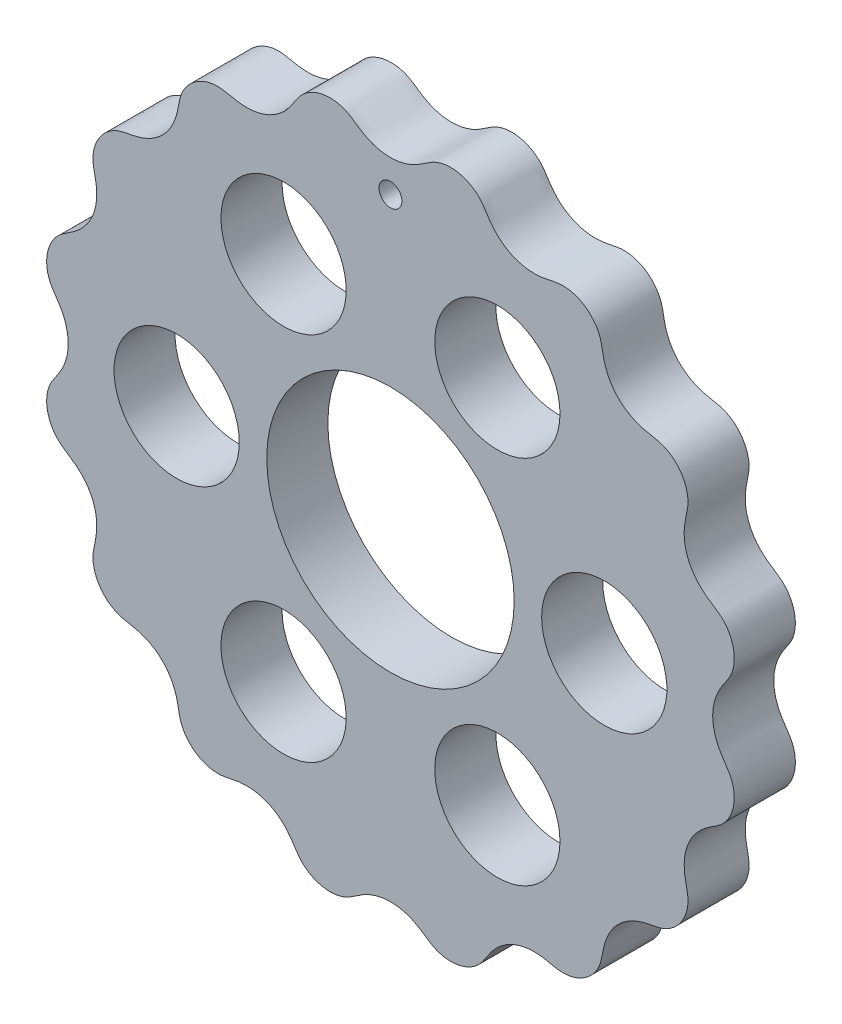
from build123d import *

# Parameters (mm, degrees)
CYCLOIDAL_START          = -4
CYCLOIDAL_SHAPE_DEPTH    = 8
SKETCH3_R                = 8.2
OUTPUT_HOLES_DEPTH       = 64.798186632
CIRPATTERN1_COUNT        = 6
CENTER_HOLE_DEPTH        = 64.798186632
CENTER_HOLE_DEPTH_BACK   = 64.798186632
SKETCH4_R                = 16.2
INDICATORHOLE_DEPTH      = 64.798186632
INDICATORHOLE_DEPTH_BACK = 64.798186632
SKETCH5_R                = 1.5


# Read off the part's stored shape, not the designer's step: Cycloidal Shape
with BuildPart() as part:
    # Cycloidal Shape outline → Cycloidal Shape (new body)
    with BuildSketch(Plane.XY.offset(CYCLOIDAL_START)):
        with BuildLine():
            Line((42.200000004, -6.0471e-05), (42.200000175, 0.001422933))
            add(Edge.make_bspline(
                [(42.200000175, 0.001422933), (42.200009793, 0.04429638), (42.201002333, 0.130355213), (42.205417899, 0.291208552), (42.217134936, 0.502376445), (42.23904282, 0.748307484), (42.276902172, 1.043005139), (42.355187031, 1.4864807), (42.504519261, 2.064777059), (42.714725772, 2.648408909), (42.986238981, 3.226181743), (43.259216415, 3.714406212), (43.514029767, 4.120442952), (43.78394798, 4.516656663), (44.058339029, 4.909655929), (44.386909136, 5.410933524), (44.747004457, 6.120481722), (45.016624744, 7.078299883), (45.070836347, 8.260501124), (44.840754087, 9.489174205), (44.381613563, 10.534977592), (43.775181626, 11.370409062), (43.087990008, 11.996449006), (42.396002443, 12.445761838), (41.693744098, 12.892169721), (41.018846878, 13.397659966), (40.392611683, 13.97543943), (39.832459458, 14.630187804), (39.233382075, 15.534850433), (38.702787982, 16.736621625), (38.432884001, 18.062354346), (38.448481733, 19.31657631), (38.582059738, 20.240796265), (38.704812873, 20.847729863), (38.812157151, 21.331100124), (38.907481526, 21.817359974), (38.964178522, 22.310094094), (38.97060628, 22.84827074), (38.910160022, 23.425564167), (38.731729101, 24.194195487), (38.352986348, 25.091100898), (37.72440338, 26.014438605), (36.849672277, 26.813178086), (36.008868598, 27.292153775), (35.276321466, 27.542000539), (34.592769181, 27.691977179), (33.902946723, 27.807011833), (33.120228086, 27.972287117), (32.262312537, 28.2481261), (31.260996096, 28.706068431), (30.183688369, 29.430209), (29.132775396, 30.519874956), (28.379656033, 31.843560482), (27.971405052, 33.084801198), (27.758536044, 34.166387243), (27.615539083, 35.059190189), (27.308374398, 35.996628219), (26.763805752, 36.912551543), (25.996094164, 37.732482419), (25.020461355, 38.396369714), (24.043230305, 38.791092717), (23.132974045, 38.965842478), (22.313461012, 38.976357024), (21.607198684, 38.876669717), (20.833553837, 38.69803688), (19.972179417, 38.527741317), (19.013370325, 38.436032664), (17.966856414, 38.481564914), (16.739227402, 38.720629378), (15.602325707, 39.180306698), (14.597997584, 39.829155361), (13.744609822, 40.620546383), (13.144351887, 41.335918565), (12.618250937, 42.108661247), (12.132222708, 42.910020292), (11.574470243, 43.575714973), (10.960536027, 44.077622647), (10.207813306, 44.528444357), (9.318589366, 44.876357641), (8.229862595, 45.073413843), (7.048656088, 45.010086405), (6.108528337, 44.741129143), (5.411411757, 44.386502168), (4.819730044, 43.999659015), (4.244264034, 43.589568187), (3.563255696, 43.153799625), (2.748480861, 42.74762643), (1.700478176, 42.374162261), (0.589312735, 42.175772778), (-0.569347107, 42.177444697), (-1.732906469, 42.393532618), (-2.674134425, 42.710736476), (-3.511428399, 43.125424238), (-4.251539333, 43.593312664), (-4.914711399, 44.068821475), (-5.555530194, 44.478569387), (-6.34965471, 44.822465702), (-7.295520664, 45.035112512), (-8.386244327, 45.055119685), (-9.572091095, 44.812858389), (-10.602785988, 44.344134307), (-11.443939436, 43.712537656), (-12.069173349, 42.99170759), (-12.522838144, 42.267676119), (-12.992397349, 41.548547704), (-13.525717187, 40.866093653), (-14.287808703, 40.085687715), (-15.348422726, 39.303146303), (-16.756152995, 38.67161998), (-18.29329355, 38.415525367), (-19.637420371, 38.472450855), (-20.642398005, 38.656474109), (-21.327291524, 38.81458434), (-22.018911636, 38.941597795), (-22.794972859, 38.996549407), (-23.760454017, 38.880347191), (-24.871565812, 38.483199893), (-25.799085999, 37.881570159), (-26.486263117, 37.215916753), (-27.008170637, 36.50508537), (-27.381322257, 35.800513842), (-27.636336053, 34.965860768), (-27.777788495, 34.034685191), (-27.973219561, 33.115418835), (-28.260598164, 32.221927308), (-28.756478934, 31.16242819), (-29.537544717, 30.052161246), (-30.685021733, 29.010873955), (-32.04053576, 28.297513608), (-33.261940047, 27.928686623), (-34.31595042, 27.736522333), (-35.177805271, 27.58636409), (-36.083685019, 27.263872428), (-36.973828754, 26.715229656), (-37.790139382, 25.929867549), (-38.45995198, 24.910723551), (-38.858934455, 23.837069338), (-39.006348996, 22.775629471), (-38.923557349, 21.787552889), (-38.710032991, 20.904170871), (-38.538204523, 20.02592026), (-38.449713847, 19.147503148), (-38.465700527, 18.064420812), (-38.68360438, 16.821588818), (-39.221539968, 15.468333899), (-40.081721676, 14.26093788), (-40.932124341, 13.459315121), (-41.643184182, 12.935605861), (-42.146184994, 12.60405966), (-42.5523704, 12.345178486), (-42.951740399, 12.075038863), (-43.328946677, 11.77425477), (-43.814254297, 11.301492281), (-44.338265322, 10.599904683), (-44.791149498, 9.644080552), (-45.052032125, 8.437672883), (-45.039617919, 7.325187948), (-44.826759079, 6.360340727), (-44.476286151, 5.550230036), (-44.056218341, 4.897650685), (-43.584832234, 4.240365371), (-43.134606161, 3.524383601), (-42.740606108, 2.735987343), (-42.435082857, 1.870894104), (-42.206013305, 0.794952395), (-42.153893458, -0.491146929), (-42.373085692, -1.795655946), (-42.817381599, -2.929984156), (-43.271015352, -3.743024194), (-43.625074453, -4.286886837), (-43.921549871, -4.712722561), (-44.215542535, -5.14054036), (-44.479710682, -5.588022163), (-44.784129557, -6.253257524), (-45.02670525, -7.169275488), (-45.075995534, -8.307090168), (-44.809931288, -9.603907808), (-44.338137195, -10.599403024), (-43.813974411, -11.301059062), (-43.328550541, -11.773786852), (-42.95125633, -12.074570808), (-42.551820058, -12.34469743), (-42.145587697, -12.603617765), (-41.642550898, -12.935234554), (-40.931467094, -13.459093196), (-40.081090947, -14.260951609), (-39.221103905, -15.468582996), (-38.683450284, -16.821967413), (-38.465805574, -18.064784344), (-38.450008769, -19.147733335), (-38.538606425, -20.02603418), (-38.710507695, -20.904157749), (-38.92397005, -21.78745165), (-39.006592296, -22.775427769), (-38.859079918, -23.836720467), (-38.460031257, -24.910281186), (-37.79015104, -25.929380603), (-36.973727316, -26.714722156), (-36.083409041, -27.263338682), (-35.177363146, -27.585724128), (-34.315389505, -27.735827432), (-33.261262257, -27.928110114), (-32.039763251, -28.297163282), (-30.684317237, -29.01082816), (-29.537046024, -30.052369557), (-28.756236764, -31.162749177), (-28.260598474, -32.222214712), (-27.973377038, -33.115648047), (-27.778071244, -34.034827619), (-27.636613841, -34.965899195), (-27.381487009, -35.800418654), (-27.008299239, -36.504863482), (-26.486377728, -37.215562088), (-25.799181236, -37.88113693), (-24.871603395, -38.482712913), (-23.76039802, -38.87979401), (-22.794784987, -38.995899259), (-22.018640086, -38.940827348), (-21.3269516, -38.813731245), (-20.641973021, -38.655618339), (-19.636855232, -38.471679064), (-18.292559383, -38.414962396), (-16.755391054, -38.671374555), (-15.347779477, -39.303206063), (-14.287371276, -40.085920589), (-13.525507521, -40.866356651), (-12.992339122, -41.548796178), (-12.522903873, -42.267880251), (-12.069241258, -42.991801019), (-11.443964883, -43.712447544), (-10.602846055, -44.343872057), (-9.572172097, -44.812483861), (-8.386313952, -45.05466412), (-7.295531011, -45.034568757), (-6.349571666, -44.821791622), (-5.555399718, -44.477737423), (-4.914560174, -44.067858472), (-4.251293044, -43.592313766), (-3.511038645, -43.124449366), (-2.673577095, -42.709840902), (-1.73217389, -42.392772264), (-0.568527679, -42.176921127), (0.590117355, -42.175498654), (1.701171077, -42.374102029), (2.748985923, -42.747707354), (3.563604531, -43.153953685), (4.244484493, -43.589743021), (4.819869981, -43.999802276), (5.41151824, -44.386546305), (6.108604917, -44.741029726), (7.0486491, -45.009845893), (8.229795161, -45.073075991), (9.318489717, -44.875947904), (10.207726229, -44.527954929), (10.960487765, -44.077005954), (11.57443855, -43.574968086), (12.132139708, -42.909106108), (12.618196253, -42.107643945), (13.144444808, -41.334867476), (13.744869059, -40.619498464), (14.598493777, -39.828167344), (15.603013516, -39.179481486), (16.740026989, -38.720043779), (17.967658376, -38.48124281), (19.014048758, -38.435906949), (19.972724962, -38.52774285), (20.833975458, -38.698102364), (21.607531607, -38.876701933), (22.313728387, -38.97627368), (23.133139389, -38.965647391), (24.043266413, -38.790820122), (25.020411559, -38.396041934), (25.996005829, -37.732086658), (26.763692679, -36.912043882), (27.308231766, -35.995949188), (27.615275845, -35.05835007), (27.758249367, -34.165447868), (27.971243495, -33.083736602), (28.379747687, -31.842426349), (29.102973058, -30.571779515), (30.2060978, -29.401533305), (31.401742888, -28.609525968), (32.444657461, -28.173307224), (33.293522051, -27.938532555), (33.914445943, -27.809383318), (34.413818088, -27.720298044), (34.912523719, -27.626863201), (35.404243845, -27.499437623), (36.066100148, -27.253854889), (36.854151353, -26.80361907), (37.6900667, -26.061480467), (38.345354937, -25.108752232), (38.731601213, -24.193727747), (38.909974339, -23.425085135), (38.97035884, -22.847662899), (38.963856982, -22.309461564), (38.907086844, -21.816657546), (38.811713388, -21.330364937), (38.704363626, -20.846931266), (38.581640541, -20.239922996), (38.448160354, -19.31558147), (38.432766924, -18.061216951), (38.702956159, -16.735436549), (39.233827707, -15.533737555), (39.833081246, -14.629225222), (40.39329257, -13.974658897), (41.019549863, -13.397055242), (41.694425974, -12.891710626), (42.396628869, -12.445414915), (43.088483875, -11.996088814), (43.775488762, -11.370019926), (44.381748184, -10.534628911), (44.840776951, -9.488849911), (45.070774277, -8.260161499), (45.016465385, -7.077897113), (44.746698371, -6.119991222), (44.386458497, -5.410416943), (43.992065005, -4.808844122), (43.644271071, -4.320869898), (43.31720487, -3.81824669), (43.034368565, -3.312574912), (42.841398016, -2.918018694), (42.678403766, -2.531962584), (42.543406043, -2.156757385), (42.429501737, -1.774321763), (42.349005977, -1.435155898), (42.29405945, -1.140762904), (42.257780941, -0.893969508), (42.234508787, -0.698069841), (42.217023523, -0.501073035), (42.205352247, -0.289874324), (42.200972676, -0.129007099), (42.199999737, -0.04293919), (42.200000004, -6.0471e-05)],
                knots=[0.069687963, 0.069687963, 0.069687963, 0.069687963, 0.069687963, 0.070247262, 0.070806561, 0.07136586, 0.071925158, 0.073043756, 0.074162354, 0.076399549, 0.078636744, 0.07998208, 0.081327416, 0.082672752, 0.084018088, 0.085363424, 0.08670876, 0.089399433, 0.092915725, 0.096432018, 0.099872099, 0.10331218, 0.105624134, 0.107936087, 0.110248041, 0.112559994, 0.114971963, 0.117383933, 0.119795902, 0.122207871, 0.12712291, 0.132037949, 0.134817995, 0.136208017, 0.13759804, 0.138988063, 0.140378086, 0.141768108, 0.143158131, 0.145018612, 0.146879092, 0.150600054, 0.15402204, 0.157444027, 0.160061305, 0.161369944, 0.162678583, 0.165295861, 0.16791314, 0.170342223, 0.172771306, 0.177629472, 0.182394453, 0.187159435, 0.1896951, 0.192230765, 0.194766431, 0.197302096, 0.200698279, 0.204094461, 0.20727045, 0.210446439, 0.212442354, 0.214438268, 0.216434183, 0.218430098, 0.221359268, 0.224288438, 0.227217608, 0.230146778, 0.235347174, 0.237947372, 0.24054757, 0.243176649, 0.245805727, 0.248434806, 0.251063885, 0.252863463, 0.254663041, 0.258262197, 0.26171964, 0.265177083, 0.267821687, 0.269143989, 0.270466291, 0.273110895, 0.275755499, 0.278209143, 0.280662787, 0.285570075, 0.288348047, 0.29112602, 0.293903992, 0.296681964, 0.298811796, 0.300941627, 0.303071458, 0.30520129, 0.30847892, 0.31175655, 0.315218438, 0.318680325, 0.321076104, 0.323471882, 0.325867661, 0.328263439, 0.330719355, 0.333175272, 0.338087104, 0.342969018, 0.347850932, 0.35048139, 0.353111847, 0.354427076, 0.355742305, 0.358372763, 0.361811912, 0.365251062, 0.368868832, 0.370677717, 0.372486602, 0.375129151, 0.377771699, 0.380414248, 0.383056796, 0.385670042, 0.388283288, 0.393509779, 0.398188755, 0.40286773, 0.405319109, 0.407770489, 0.410221868, 0.412673248, 0.41604608, 0.419418913, 0.422833629, 0.426248345, 0.428797252, 0.43134616, 0.433895068, 0.436443975, 0.438840021, 0.441236066, 0.446028156, 0.450526774, 0.455025392, 0.457730018, 0.459082331, 0.460434643, 0.461786956, 0.463139269, 0.464491582, 0.465843894, 0.469378617, 0.47291334, 0.476250684, 0.479588029, 0.481761248, 0.483934468, 0.486107688, 0.488280908, 0.490848144, 0.49341538, 0.495982615, 0.498549851, 0.503163584, 0.507777317, 0.510690451, 0.512147017, 0.513603584, 0.515060151, 0.516516717, 0.517973284, 0.519429851, 0.523255612, 0.527081373, 0.530616513, 0.534151653, 0.535504124, 0.536856595, 0.538209067, 0.539561538, 0.540914009, 0.542266481, 0.544971423, 0.54947059, 0.553969756, 0.558761247, 0.561156992, 0.563552738, 0.56610135, 0.568649963, 0.571198576, 0.573747189, 0.577161495, 0.580575801, 0.583949045, 0.587322289, 0.589773982, 0.592225675, 0.594677369, 0.597129062, 0.601808584, 0.606488106, 0.61171402, 0.614326977, 0.616939934, 0.619582184, 0.622224435, 0.624866685, 0.627508935, 0.629317614, 0.631126293, 0.634743651, 0.638183207, 0.641622764, 0.644253535, 0.64556892, 0.646884306, 0.649515077, 0.652145848, 0.657028325, 0.661910802, 0.666822015, 0.669277621, 0.671733227, 0.674128729, 0.67652423, 0.678919731, 0.681315233, 0.684776698, 0.688238163, 0.691516196, 0.69479423, 0.696924316, 0.699054403, 0.70118449, 0.703314577, 0.706092889, 0.708871201, 0.711649513, 0.714427825, 0.719334552, 0.721787915, 0.724241278, 0.726885568, 0.729529858, 0.730852003, 0.732174149, 0.734818439, 0.738275477, 0.741732516, 0.745332083, 0.747131867, 0.74893165, 0.751561029, 0.754190408, 0.756819786, 0.759449165, 0.762049653, 0.764650141, 0.769851116, 0.772779921, 0.775708727, 0.778637532, 0.781566337, 0.783562017, 0.785557697, 0.787553378, 0.789549058, 0.792724655, 0.795900252, 0.799296846, 0.802693441, 0.805229398, 0.807765355, 0.810301313, 0.81283727, 0.817602854, 0.822368438, 0.826548253, 0.830728067, 0.83357562, 0.834999396, 0.836423173, 0.837846949, 0.839270725, 0.840694502, 0.842118278, 0.84575653, 0.849394782, 0.853116163, 0.854976853, 0.856837544, 0.858227724, 0.859617904, 0.861008084, 0.862398264, 0.863788444, 0.865178624, 0.867958984, 0.872874555, 0.877790127, 0.880201818, 0.882613508, 0.885025199, 0.88743689, 0.889748542, 0.892060194, 0.894371847, 0.896683499, 0.900123158, 0.903562818, 0.907079529, 0.91059624, 0.913287228, 0.914632722, 0.915978216, 0.918669203, 0.920014697, 0.921360191, 0.922478926, 0.923597661, 0.924716396, 0.925835131, 0.926953867, 0.927513234, 0.928072602, 0.928631969, 0.929191337, 0.929750704, 0.930310072, 0.930310072, 0.930310072, 0.930310072, 0.930310072], degree=4))
        make_face()
    extrude(amount=CYCLOIDAL_SHAPE_DEPTH)

    # Sketch3 → Output Holes (cut, symmetric)
    with BuildSketch(Plane.XY):
        with Locations((-28, 0)):
            Circle(SKETCH3_R)
    output_holes = extrude(amount=OUTPUT_HOLES_DEPTH, both=True, mode=Mode.SUBTRACT)

    # CirPattern1: Output Holes ×6 about axis
    cirpattern1_axis = Axis((0, 0, 0), (0, 0, 1))
    for i in range(1, CIRPATTERN1_COUNT):
        add(output_holes.rotate(cirpattern1_axis, i * 360 / CIRPATTERN1_COUNT), mode=Mode.SUBTRACT)

    # Sketch4 → Center Hole (cut, two sides: drawn at the far end of the back side and taken through both)
    with BuildSketch(Plane.XY.offset(-CENTER_HOLE_DEPTH_BACK)):
        Circle(SKETCH4_R)
    extrude(amount=CENTER_HOLE_DEPTH + CENTER_HOLE_DEPTH_BACK, mode=Mode.SUBTRACT)

    # Sketch5 → IndicatorHole (cut, two sides: drawn at the far end of the back side and taken through both)
    with BuildSketch(Plane.XY.offset(-INDICATORHOLE_DEPTH_BACK)):
        with Locations((0, 38)):
            Circle(SKETCH5_R)
    extrude(amount=INDICATORHOLE_DEPTH + INDICATORHOLE_DEPTH_BACK, mode=Mode.SUBTRACT)


solid = part.part
